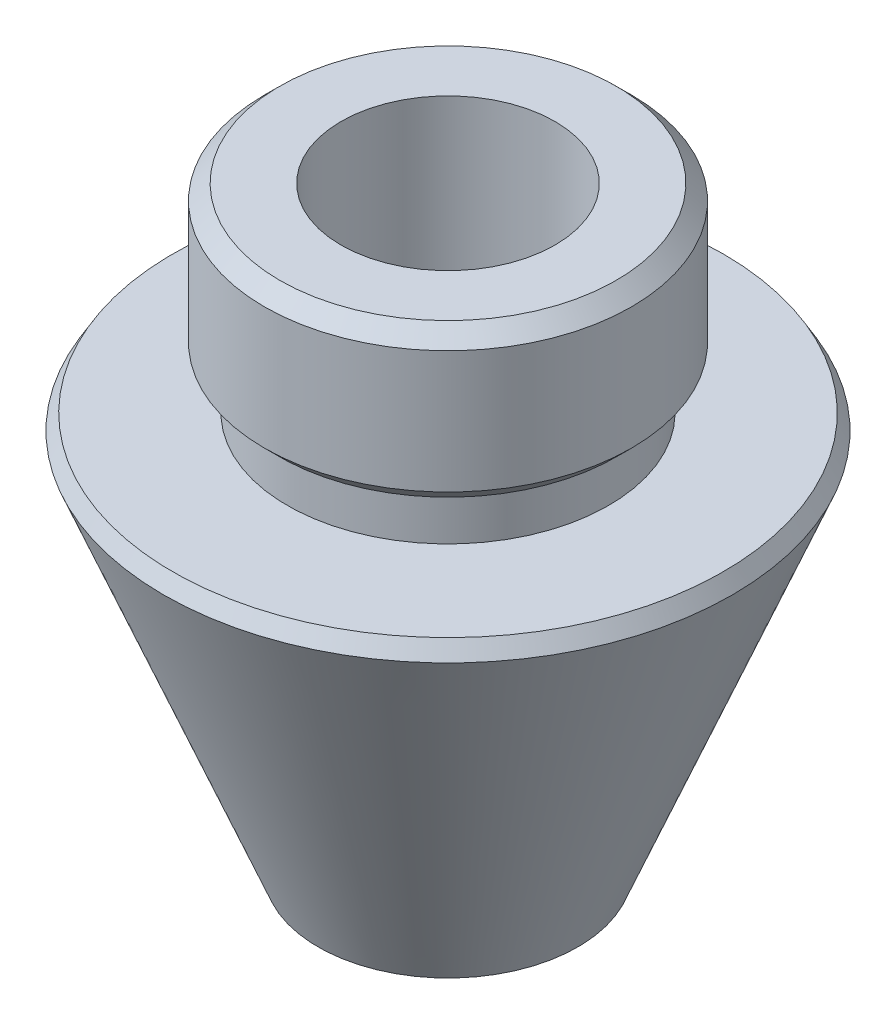
from build123d import *

# Parameters (mm, degrees)
CHANFRO1_SIZE = 1
CHANFRO2_SIZE = 1
FILETE1_R     = 0.5


with BuildPart() as part:
    # Esboço1 → Revolução1 (revolve)
    with BuildSketch(Plane(origin=(0, 0, 0), x_dir=(0, 0, -1), z_dir=(1, 0, 0))):
        Polygon((18, 18.768101913), (10.5, 18.768101913), (10.5, 21.768101913), (12, 21.768101913), (12, 31.768101913), (7, 31.768101913), (7, -7.231898087), (8.495318128, -7.231898087), (18.5883066, 17.749124991), align=None)
    revolve(axis=Axis((0, 0, 0), (0, 1, 0)))

    # Chanfro1
    chanfro1_edges = [part.edges().sort_by_distance(p)[0] for p in [
        (0, 31.768101913, 12),
    ]]
    chamfer(chanfro1_edges, length=CHANFRO1_SIZE)

    # Chanfro2
    chanfro2_edges = [part.edges().sort_by_distance(p)[0] for p in [
        (0, 21.768101913, 12),
    ]]
    chamfer(chanfro2_edges, length=CHANFRO2_SIZE)

    # Filete1
    filete1_edges = [part.edges().sort_by_distance(p)[0] for p in [
        (0, -7.231898087, 7),
    ]]
    fillet(filete1_edges, radius=FILETE1_R)


solid = part.part
